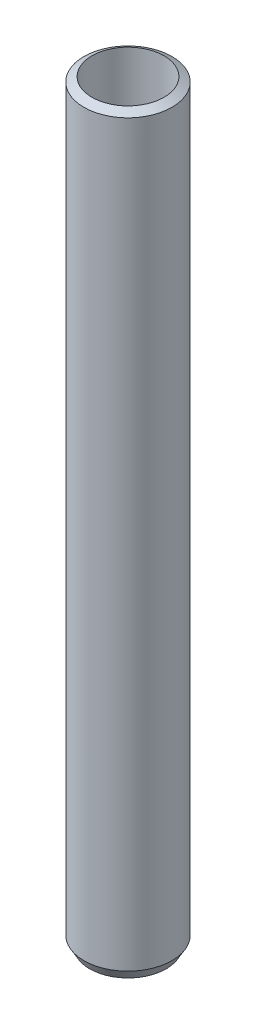
from build123d import *

# Parameters (mm, degrees)
SKETCH1_R           = 35
BOSS_EXTRUDE1_DEPTH = 600
SKETCH2_R           = 28.627137147
CUT_EXTRUDE1_DEPTH  = 603.038204768
CHAMFER1_SIZE       = 4.595275
CHAMFER1_SIZE_2     = 7.95925


with BuildPart() as part:
    # Sketch1 → Boss-Extrude1 (new body)
    with BuildSketch(Plane(origin=(0, 0, 0), x_dir=(1, 0, 0), z_dir=(0, 1, 0))):
        with Locations(Location((0, 0, 0), (0, 0, 270))):
            Circle(SKETCH1_R)
    extrude(amount=BOSS_EXTRUDE1_DEPTH)

    # Sketch2 → Cut-Extrude1 (cut, through all)
    with BuildSketch(Plane(origin=(0, 0, 0), x_dir=(1, 0, 0), z_dir=(0, 1, 0))):
        with Locations(Location((0, 0, 0), (0, 0, 270))):
            Circle(SKETCH2_R)
    extrude(amount=CUT_EXTRUDE1_DEPTH, mode=Mode.SUBTRACT)

    # Chamfer1
    # the kernel refuses this chamfer: 7.95925, 4.595275 mm, written as the material it takes off along each edge
    with BuildSketch(Plane(origin=(0, 600, 0), x_dir=(0, 0, 1), z_dir=(-1, 0, 0))) as chamfer1_piece_1:
        Polygon((35, -CHAMFER1_SIZE), (35 - CHAMFER1_SIZE_2, 0), (35, 0), align=None)
    revolve(axis=Axis((0, 600, 0), (0, 1, 0)), mode=Mode.SUBTRACT)
    with BuildSketch(Plane(origin=(0, 0, 0), x_dir=(0, 0, 1), z_dir=(-1, 0, 0))) as chamfer1_piece_2:
        Polygon((35, CHAMFER1_SIZE_2), (35 - CHAMFER1_SIZE, 0), (35, 0), align=None)
    revolve(axis=Axis((0, 0, 0), (0, 1, 0)), mode=Mode.SUBTRACT)


solid = part.part
